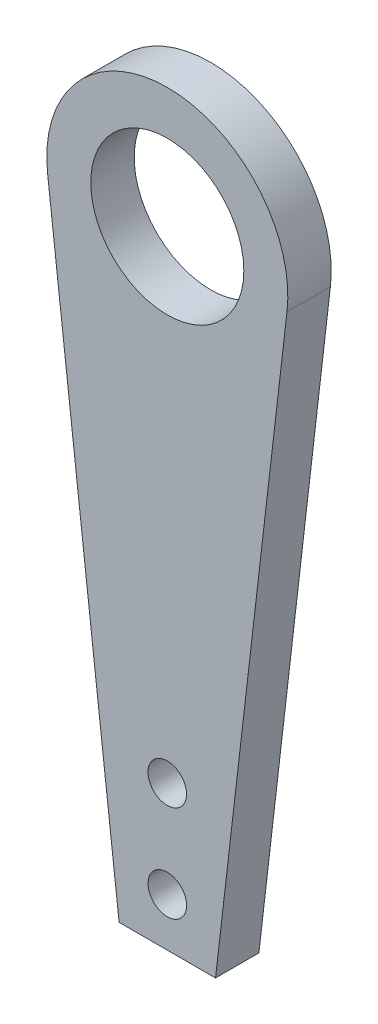
from build123d import *

# Parameters (mm, degrees)
SKETCH1_R           = 2
SKETCH1_R_2         = 7.9375
BOSS_EXTRUDE2_DEPTH = 4.5


with BuildPart() as part:
    # Sketch1 → Boss-Extrude2 (new body)
    with BuildSketch(Plane.XY):
        with BuildLine():
            Line((-5, -5), (5, -5))
            Line((5, -5), (12.415756662, 58.551212051))
            ThreePointArc((12.415756662, 58.551212051), (0, 72.5), (-12.415756662, 58.551212051))
            Line((-12.415756662, 58.551212051), (-5, -5))
        make_face()
        Circle(SKETCH1_R, mode=Mode.SUBTRACT)
        with Locations((0, 60)):
            Circle(SKETCH1_R_2, mode=Mode.SUBTRACT)
        with Locations((0, 10)):
            Circle(SKETCH1_R, mode=Mode.SUBTRACT)
    extrude(amount=BOSS_EXTRUDE2_DEPTH)


solid = part.part
